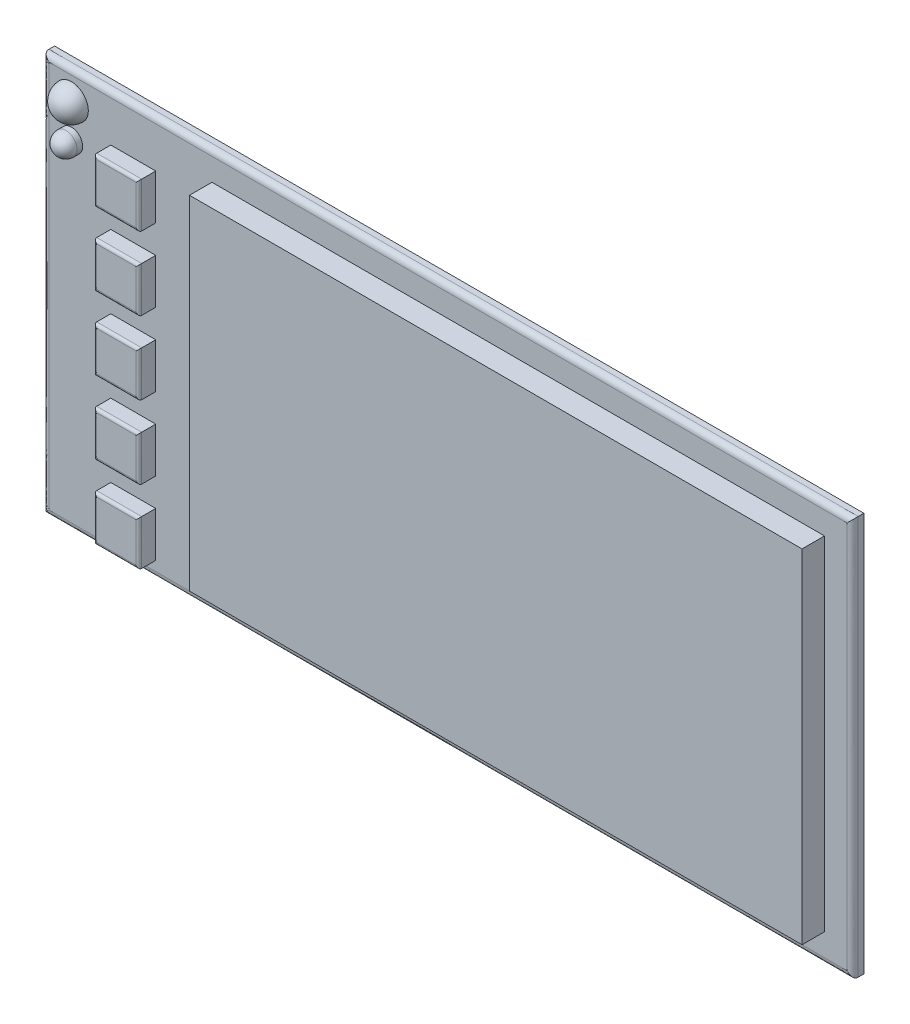
from build123d import *

# Parameters (mm, degrees)
SKETCH1_W           = 144
SKETCH1_H           = 71
SKETCH1_R           = 2.5
SKETCH1_W_2         = 109
SKETCH1_H_2         = 61
SKETCH1_W_3         = 8
SKETCH1_H_3         = 8
BOSS_EXTRUDE1_DEPTH = 2
SKETCH1_2_W         = 109
SKETCH1_2_H         = 61
BOSS_EXTRUDE2_DEPTH = 6
SKETCH1_3_W         = 8
SKETCH1_3_H         = 8
BOSS_EXTRUDE3_DEPTH = 5
SKETCH3_R           = 3
BOSS_EXTRUDE4_DEPTH = 3
FILLET3_R           = 3
FILLET4_SIZE        = 0.5
FILLET5_SIZE        = 1
SKETCH4_R           = 2
BOSS_EXTRUDE5_DEPTH = 3
FILLET8_R           = 2


# Some blends are built 0.0001 mm under size
with BuildPart() as part:
    # Sketch1 → Boss-Extrude1 (new body)
    with BuildSketch(Plane.XY):
        Rectangle(SKETCH1_W, SKETCH1_H)
        with Locations((-67, 30.5)):
            Circle(SKETCH1_R, mode=Mode.SUBTRACT)
        with Locations((12.5, 0)):
            Rectangle(SKETCH1_W_2, SKETCH1_H_2, mode=Mode.SUBTRACT)
        with Locations((-56, 10.236341072)):
            Rectangle(SKETCH1_W_3, SKETCH1_H_3, mode=Mode.SUBTRACT)
        with Locations((-56, 23.236341072)):
            Rectangle(SKETCH1_W_3, SKETCH1_H_3, mode=Mode.SUBTRACT)
        with Locations((-56, -2.763658928)):
            Rectangle(SKETCH1_W_3, SKETCH1_H_3, mode=Mode.SUBTRACT)
        with Locations((-56, -15.763658928)):
            Rectangle(SKETCH1_W_3, SKETCH1_H_3, mode=Mode.SUBTRACT)
        with Locations((-56, -28.763658928)):
            Rectangle(SKETCH1_W_3, SKETCH1_H_3, mode=Mode.SUBTRACT)
    extrude(amount=BOSS_EXTRUDE1_DEPTH)

    # Sketch1<2> → Boss-Extrude2 (add)
    with BuildSketch(Plane.XY):
        with Locations((12.5, 0)):
            Rectangle(SKETCH1_2_W, SKETCH1_2_H)
    extrude(amount=BOSS_EXTRUDE2_DEPTH)

    # Sketch1<3> → Boss-Extrude3 (add)
    with BuildSketch(Plane.XY):
        with Locations((-56, 10.236341072)):
            Rectangle(SKETCH1_3_W, SKETCH1_3_H)
        with Locations((-56, -2.763658928)):
            Rectangle(SKETCH1_3_W, SKETCH1_3_H)
        with Locations((-56, -15.763658928)):
            Rectangle(SKETCH1_3_W, SKETCH1_3_H)
        with Locations((-56, -28.763658928)):
            Rectangle(SKETCH1_3_W, SKETCH1_3_H)
        with Locations((-56, 23.236341072)):
            Rectangle(SKETCH1_3_W, SKETCH1_3_H)
    extrude(amount=BOSS_EXTRUDE3_DEPTH)

    # Sketch3 → Boss-Extrude4 (add)
    with BuildSketch(Plane.XY.offset(2)):
        with Locations((-67, 30.5)):
            Circle(SKETCH3_R)
    extrude(amount=BOSS_EXTRUDE4_DEPTH)

    # Fillet3
    fillet3_edges = [part.edges().sort_by_distance(p)[0] for p in [
        (-70, 30.5, 5),
    ]]
    fillet(fillet3_edges, radius=FILLET3_R - 0.0001)  # a hair under: the kernel refuses the full size

    # Fillet4
    # a fillet whose section is not a circle: 0.5 mm, written as the material it takes off along each edge
    with BuildSketch(Plane(origin=(-60, -34.013658928, 5), x_dir=(0, 0, -1), z_dir=(0, 1, 0)), Plane(origin=(-61.25, -24.763658928, 5), x_dir=(0, 0, -1), z_dir=(1, 0, 0)), Plane(origin=(-52, -23.513658928, 5), x_dir=(0, 0, -1), z_dir=(0, -1, 0)), Plane(origin=(-50.75, -32.763658928, 5), x_dir=(0, 0, -1), z_dir=(-1, 0, 0)), Plane(origin=(-60, -21.013658928, 5), x_dir=(0, 0, -1), z_dir=(0, 1, 0)), Plane(origin=(-61.25, -11.763658928, 5), x_dir=(0, 0, -1), z_dir=(1, 0, 0)), Plane(origin=(-52, -10.513658928, 5), x_dir=(0, 0, -1), z_dir=(0, -1, 0)), Plane(origin=(-50.75, -19.763658928, 5), x_dir=(0, 0, -1), z_dir=(-1, 0, 0)), Plane(origin=(-60, -8.013658928, 5), x_dir=(0, 0, -1), z_dir=(0, 1, 0)), Plane(origin=(-61.25, 1.236341072, 5), x_dir=(0, 0, -1), z_dir=(1, 0, 0)), Plane(origin=(-52, 2.486341072, 5), x_dir=(0, 0, -1), z_dir=(0, -1, 0)), Plane(origin=(-50.75, -6.763658928, 5), x_dir=(0, 0, -1), z_dir=(-1, 0, 0)), Plane(origin=(-60, 4.986341072, 5), x_dir=(0, 0, -1), z_dir=(0, 1, 0)), Plane(origin=(-61.25, 14.236341072, 5), x_dir=(0, 0, -1), z_dir=(1, 0, 0)), Plane(origin=(-52, 15.486341072, 5), x_dir=(0, 0, -1), z_dir=(0, -1, 0)), Plane(origin=(-50.75, 6.236341072, 5), x_dir=(0, 0, -1), z_dir=(-1, 0, 0)), Plane(origin=(-50.75, 19.236341072, 5), x_dir=(0, 0, -1), z_dir=(-1, 0, 0)), Plane(origin=(-60, 17.986341072, 5), x_dir=(0, 0, -1), z_dir=(0, 1, 0)), Plane(origin=(-61.25, 27.236341072, 5), x_dir=(0, 0, -1), z_dir=(1, 0, 0)), Plane(origin=(-52, 28.486341072, 5), x_dir=(0, 0, -1), z_dir=(0, -1, 0))) as fillet4_piece_1:
        with BuildLine():
            Bezier((FILLET4_SIZE, 0), (0, 0), (0, -FILLET4_SIZE), weights=[1, 1, 1])
            Line((0, -FILLET4_SIZE), (0, 0))
            Line((0, 0), (FILLET4_SIZE, 0))
        make_face()
    extrude(amount=10.5, mode=Mode.SUBTRACT)

    # Fillet5
    # a fillet whose section is not a circle: 1 mm, written as the material it takes off along each edge
    with BuildSketch(Plane(origin=(72, 38, 2), x_dir=(-1, 0, 0), z_dir=(0, -1, 0)), Plane(origin=(-72, -38, 2), x_dir=(1, 0, 0), z_dir=(0, 1, 0))) as fillet5_piece_1:
        with BuildLine():
            Bezier((FILLET5_SIZE, 0), (0, 0), (0, FILLET5_SIZE), weights=[1, 1, 1])
            Line((0, FILLET5_SIZE), (0, 0))
            Line((0, 0), (FILLET5_SIZE, 0))
        make_face()
    extrude(amount=76, mode=Mode.SUBTRACT)
    with BuildSketch(Plane(origin=(74.5, -35.5, 2), x_dir=(0, 1, 0), z_dir=(-1, 0, 0)), Plane(origin=(-74.5, 35.5, 2), x_dir=(0, -1, 0), z_dir=(1, 0, 0))) as fillet5_piece_2:
        with BuildLine():
            Bezier((FILLET5_SIZE, 0), (0, 0), (0, FILLET5_SIZE), weights=[1, 1, 1])
            Line((0, FILLET5_SIZE), (0, 0))
            Line((0, 0), (FILLET5_SIZE, 0))
        make_face()
    extrude(amount=149, mode=Mode.SUBTRACT)

    # Sketch4 → Boss-Extrude5 (add)
    with BuildSketch(Plane.XY.offset(2)):
        with Locations((-67, 24.5)):
            Circle(SKETCH4_R)
    extrude(amount=BOSS_EXTRUDE5_DEPTH)

    # Fillet8
    fillet8_edges = [part.edges().sort_by_distance(p)[0] for p in [
        (-69, 24.5, 5),
    ]]
    fillet(fillet8_edges, radius=FILLET8_R)


solid = part.part
